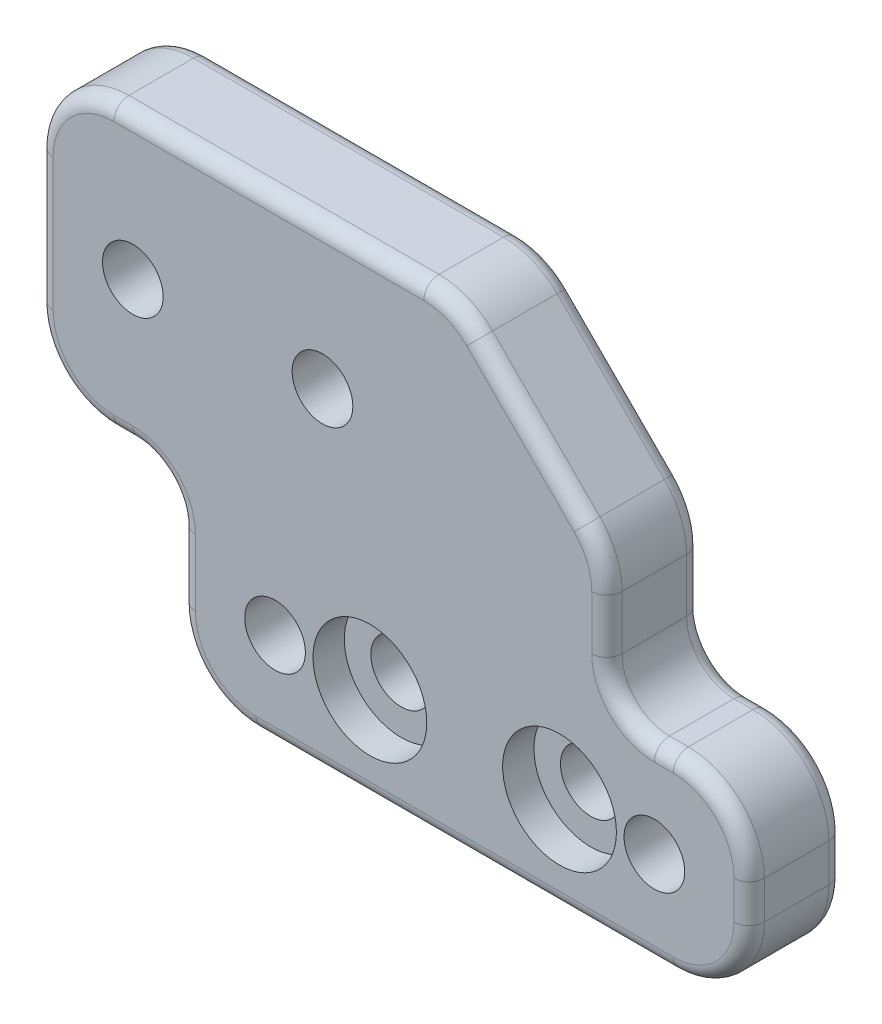
from build123d import *

# Parameters (mm, degrees)
SKETCH2_W                       = 15
SKETCH2_H                       = 15
BOSS_EXTRUDE1_DEPTH             = 5
M3_CLEARANCE_HOLE1_OUTLINE_R    = 1.6
M3_CLEARANCE_HOLE1_DEPTH        = 5
CBORE_FOR_M3_SBHCS1_D           = 3.2
CBORE_FOR_M3_SBHCS1_CBORE_D     = 6
CBORE_FOR_M3_SBHCS1_CBORE_DEPTH = 1.65
CHAMFER1_SIZE                   = 8
FILLET1_R                       = 4
FILLET2_R                       = 2.5
FILLET3_R                       = 0.8


# Read off the part's stored shape, not the designer's step: M3 Clearance Hole1
with BuildPart() as part:
    # Sketch2 → Boss-Extrude1 (new body)
    with BuildSketch(Plane.XY):
        Polygon((0, 10), (0, 0), (30, 0), (30, 10), (22.5, 10), (7.5, 10), align=None)
        Polygon((-7.5, 10), (0, 10), (7.5, 10), (7.5, 25), (-7.5, 25), align=None)
        with Locations((15, 17.5)):
            Rectangle(SKETCH2_W, SKETCH2_H)
    extrude(amount=BOSS_EXTRUDE1_DEPTH)

    # M3 Clearance Hole1 outline → M3 Clearance Hole1 (cut)
    with BuildSketch(Plane.XY):
        with Locations((7.5, 17.5)):
            Circle(M3_CLEARANCE_HOLE1_OUTLINE_R)
        with Locations((-2.5, 17.5)):
            Circle(M3_CLEARANCE_HOLE1_OUTLINE_R)
        with Locations((25, 5)):
            Circle(M3_CLEARANCE_HOLE1_OUTLINE_R)
        with Locations((5, 5)):
            Circle(M3_CLEARANCE_HOLE1_OUTLINE_R)
    extrude(amount=M3_CLEARANCE_HOLE1_DEPTH, mode=Mode.SUBTRACT)

    # CBORE for M3 SBHCS1 (through all)
    with Locations(Plane.XY.offset(5)):
        with Locations((20, 5), (10, 5)):
            CounterBoreHole(CBORE_FOR_M3_SBHCS1_D / 2, CBORE_FOR_M3_SBHCS1_CBORE_D / 2, CBORE_FOR_M3_SBHCS1_CBORE_DEPTH)

    # Chamfer1
    chamfer1_edges = [part.edges().sort_by_distance(p)[0] for p in [
        (22.5, 25, 2.5),
    ]]
    chamfer(chamfer1_edges, length=CHAMFER1_SIZE)

    # Fillet1
    fillet1_edges = [part.edges().sort_by_distance(p)[0] for p in [
        (-7.5, 10, 2.5),
        (-7.5, 25, 2.5),
        (30, 10, 2.5),
        (30, 0, 2.5),
        (0, 0, 2.5),
        (14.5, 25, 2.5),
        (22.5, 17, 2.5),
    ]]
    fillet(fillet1_edges, radius=FILLET1_R)

    # Fillet2
    fillet2_edges = [part.edges().sort_by_distance(p)[0] for p in [
        (22.5, 10, 2.5),
        (0, 10, 2.5),
    ]]
    fillet(fillet2_edges, radius=FILLET2_R)

    # Fillet3
    fillet3_edges = [part.edges().sort_by_distance(p)[0] for p in [
        (14.37387948, 24.69551813, 5),
        (22.5, 13.921572875, 0),
        (22.5, 13.921572875, 5),
        (25.5, 10, 5),
        (25.5, 10, 0),
        (-3, 10, 5),
        (-3, 10, 0),
        (23.232233047, 10.732233047, 0),
        (23.232233047, 10.732233047, 5),
        (-0.732233047, 9.267766953, 0),
        (-0.732233047, 9.267766953, 5),
        (4.671572875, 25, 5),
        (4.671572875, 25, 0),
        (18.5, 21, 0),
        (30, 5, 0),
        (15, 0, 0),
        (0, 5.75, 0),
        (-7.5, 17.5, 0),
        (1.171572875, 1.171572875, 0),
        (28.828427125, 1.171572875, 0),
        (28.828427125, 8.828427125, 0),
        (-6.328427125, 11.171572875, 0),
        (-6.328427125, 23.828427125, 0),
        (22.19551813, 16.87387948, 0),
        (14.37387948, 24.69551813, 0),
        (18.5, 21, 5),
        (-7.5, 17.5, 5),
        (0, 5.75, 5),
        (15, 0, 5),
        (30, 5, 5),
        (1.171572875, 1.171572875, 5),
        (28.828427125, 1.171572875, 5),
        (28.828427125, 8.828427125, 5),
        (-6.328427125, 11.171572875, 5),
        (-6.328427125, 23.828427125, 5),
        (22.19551813, 16.87387948, 5),
    ]]
    fillet(fillet3_edges, radius=FILLET3_R)


solid = part.part
